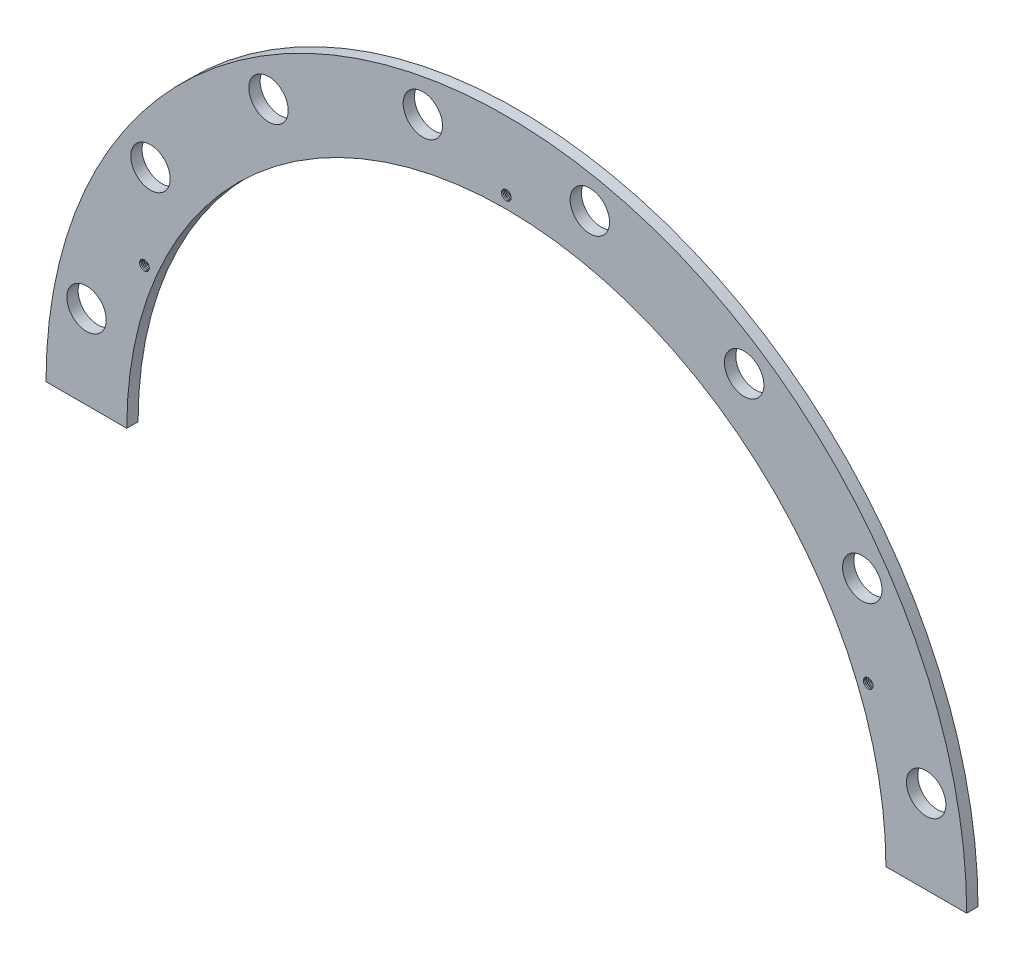
from build123d import *

# Parameters (mm, degrees)
ESTRUSIONE_ESTRUSIONE1_DEPTH = 7
SCHIZZO2_R                   = 12.2
TAGLIO_ESTRUSIONE1_DEPTH     = 404.111647066
RIPETIZIONECIRCOLARE1_COUNT  = 8
RIPETIZIONECIRCOLARE1_ANGLE  = 157.5
SCHIZZO3_R                   = 3
TAGLIO_ESTRUSIONE2_DEPTH     = 404.111647066
RIPETIZIONECIRCOLARE2_COUNT  = 3
RIPETIZIONECIRCOLARE2_ANGLE  = 135
FILETTATURA1_PITCH           = 1
FILETTATURA2_PITCH           = 1
FILETTATURA3_PITCH           = 1


with BuildPart() as part:
    # Schizzo1 → Estrusione-Estrusione1 (new body)
    with BuildSketch(Plane.XY):
        with BuildLine():
            Line((-285, 0), (-235, 0))
            ThreePointArc((-235, 0), (0, 235), (235, 0))
            Line((235, 0), (285, 0))
            ThreePointArc((285, 0), (0, 285), (-285, 0))
        make_face()
    extrude(amount=ESTRUSIONE_ESTRUSIONE1_DEPTH)

    # Schizzo2 → Taglio-Estrusione1 (cut, through all)
    with BuildSketch(Plane.XY.offset(7)):
        with Locations((-259.908099307, 51.698935334)):
            Circle(SCHIZZO2_R)
    taglio_estrusione1 = extrude(amount=-TAGLIO_ESTRUSIONE1_DEPTH, mode=Mode.SUBTRACT)

    # RipetizioneCircolare1: Taglio-Estrusione1 ×8 about axis
    ripetizionecircolare1_axis = Axis((0, 0, 0), (0, 0, -1))
    for i in range(1, RIPETIZIONECIRCOLARE1_COUNT):
        add(taglio_estrusione1.rotate(ripetizionecircolare1_axis, i * RIPETIZIONECIRCOLARE1_ANGLE / (RIPETIZIONECIRCOLARE1_COUNT - 1)), mode=Mode.SUBTRACT)

    # Schizzo3 → Taglio-Estrusione2 (cut, through all)
    with BuildSketch(Plane.XY.offset(7)):
        with Locations((-224.040786634, 92.800732349)):
            Circle(SCHIZZO3_R)
    taglio_estrusione2 = extrude(amount=-TAGLIO_ESTRUSIONE2_DEPTH, mode=Mode.SUBTRACT)

    # RipetizioneCircolare2: Taglio-Estrusione2 ×3 about axis
    ripetizionecircolare2_axis = Axis((0, 0, 0), (0, 0, -1))
    for i in range(1, RIPETIZIONECIRCOLARE2_COUNT):
        add(taglio_estrusione2.rotate(ripetizionecircolare2_axis, i * RIPETIZIONECIRCOLARE2_ANGLE / (RIPETIZIONECIRCOLARE2_COUNT - 1)), mode=Mode.SUBTRACT)

    # Filettatura1: arcs per turn and ends read off the stored shape
    # Filettatura1: the profile of Profilo filettatura1 profile screwed along a right-hand helix through 7 turns, 8 arcs to a turn; built about Z, then put on its axis
    filettatura1_z = Axis((0, 0, 0), (0, 0, 1))
    filettatura1_corners = [(2.9997, 0, -0.000173205), (3.541265875, 0, 0.312499999), (3.541265875, 0, 0.437499999), (2.9997, 0, 0.750173202)]
    with BuildLine(mode=Mode.PRIVATE) as filettatura1_profile:
        Line(filettatura1_corners[0], filettatura1_corners[1])
        Line(filettatura1_corners[1], filettatura1_corners[2])
        Line(filettatura1_corners[2], filettatura1_corners[3])
        Line(filettatura1_corners[3], filettatura1_corners[0])
    filettatura1_cap = Face(filettatura1_profile.wire())
    filettatura1_turn_angles = [0, 22.5, 45, 67.5, 90, 112.5, 135, 157.5, 180, 202.5, 225, 247.5, 270, 292.5, 315, 337.5, 360]
    filettatura1_turn_weights = [1, 0.9238795325112867, 1, 0.9238795325112867, 1, 0.9238795325112867, 1, 0.9238795325112867, 1, 0.9238795325112867, 1, 0.9238795325112867, 1, 0.9238795325112867, 1, 0.9238795325112867, 1]
    filettatura1_turn_rails = [Edge.make_bspline([Vector(p[0], p[1], 0).rotate(filettatura1_z, filettatura1_turn_angles[k]) / filettatura1_turn_weights[k] + Vector(0, 0, p[2] + FILETTATURA1_PITCH * filettatura1_turn_angles[k] / 360) for k in range(17)], [0, 0, 0, 1, 1, 2, 2, 3, 3, 4, 4, 5, 5, 6, 6, 7, 7, 8, 8, 8], 2, filettatura1_turn_weights) for p in filettatura1_corners]
    filettatura1_turn_sides = [Face.make_surface_from_curves(filettatura1_turn_rails[p[0]], filettatura1_turn_rails[p[1]]) for p in [(0, 1), (1, 2), (2, 3), (3, 0)]]
    filettatura1 = Plane(origin=(0, 242.5, 7), x_dir=(-1, 0, 0), z_dir=(0, 0, -1)) * Solid(Shell([*[p.moved(Location((0, 0, FILETTATURA1_PITCH * i))) for i in range(7) for p in filettatura1_turn_sides], filettatura1_cap, filettatura1_cap.rotate(filettatura1_z, 2520).moved(Location((0, 0, FILETTATURA1_PITCH * 2520 / 360)))]))
    add(filettatura1, mode=Mode.SUBTRACT)

    # Filettatura2: arcs per turn and ends read off the stored shape
    # Filettatura2: the profile of Profilo filettatura2 profile screwed along a right-hand helix through 7 turns, 8 arcs to a turn; built about Z, then put on its axis
    filettatura2_z = Axis((0, 0, 0), (0, 0, 1))
    filettatura2_corners = [(2.9997, 0, -0.000173205), (3.541265875, 0, 0.312499999), (3.541265875, 0, 0.437499999), (2.9997, 0, 0.750173202)]
    with BuildLine(mode=Mode.PRIVATE) as filettatura2_profile:
        Line(filettatura2_corners[0], filettatura2_corners[1])
        Line(filettatura2_corners[1], filettatura2_corners[2])
        Line(filettatura2_corners[2], filettatura2_corners[3])
        Line(filettatura2_corners[3], filettatura2_corners[0])
    filettatura2_cap = Face(filettatura2_profile.wire())
    filettatura2_turn_angles = [0, 22.5, 45, 67.5, 90, 112.5, 135, 157.5, 180, 202.5, 225, 247.5, 270, 292.5, 315, 337.5, 360]
    filettatura2_turn_weights = [1, 0.9238795325112867, 1, 0.9238795325112867, 1, 0.9238795325112867, 1, 0.9238795325112867, 1, 0.9238795325112867, 1, 0.9238795325112867, 1, 0.9238795325112867, 1, 0.9238795325112867, 1]
    filettatura2_turn_rails = [Edge.make_bspline([Vector(p[0], p[1], 0).rotate(filettatura2_z, filettatura2_turn_angles[k]) / filettatura2_turn_weights[k] + Vector(0, 0, p[2] + FILETTATURA2_PITCH * filettatura2_turn_angles[k] / 360) for k in range(17)], [0, 0, 0, 1, 1, 2, 2, 3, 3, 4, 4, 5, 5, 6, 6, 7, 7, 8, 8, 8], 2, filettatura2_turn_weights) for p in filettatura2_corners]
    filettatura2_turn_sides = [Face.make_surface_from_curves(filettatura2_turn_rails[p[0]], filettatura2_turn_rails[p[1]]) for p in [(0, 1), (1, 2), (2, 3), (3, 0)]]
    filettatura2 = Plane(origin=(-224.040786634, 92.800732349, 7), x_dir=(-1, 0, 0), z_dir=(0, 0, -1)) * Solid(Shell([*[p.moved(Location((0, 0, FILETTATURA2_PITCH * i))) for i in range(7) for p in filettatura2_turn_sides], filettatura2_cap, filettatura2_cap.rotate(filettatura2_z, 2520).moved(Location((0, 0, FILETTATURA2_PITCH * 2520 / 360)))]))
    add(filettatura2, mode=Mode.SUBTRACT)

    # Filettatura3: arcs per turn and ends read off the stored shape
    # Filettatura3: the profile of Profilo filettatura3 profile screwed along a right-hand helix through 7 turns, 8 arcs to a turn; built about Z, then put on its axis
    filettatura3_z = Axis((0, 0, 0), (0, 0, 1))
    filettatura3_corners = [(2.9997, 0, -0.000173205), (3.541265875, 0, 0.312499999), (3.541265875, 0, 0.437499999), (2.9997, 0, 0.750173202)]
    with BuildLine(mode=Mode.PRIVATE) as filettatura3_profile:
        Line(filettatura3_corners[0], filettatura3_corners[1])
        Line(filettatura3_corners[1], filettatura3_corners[2])
        Line(filettatura3_corners[2], filettatura3_corners[3])
        Line(filettatura3_corners[3], filettatura3_corners[0])
    filettatura3_cap = Face(filettatura3_profile.wire())
    filettatura3_turn_angles = [0, 22.5, 45, 67.5, 90, 112.5, 135, 157.5, 180, 202.5, 225, 247.5, 270, 292.5, 315, 337.5, 360]
    filettatura3_turn_weights = [1, 0.9238795325112867, 1, 0.9238795325112867, 1, 0.9238795325112867, 1, 0.9238795325112867, 1, 0.9238795325112867, 1, 0.9238795325112867, 1, 0.9238795325112867, 1, 0.9238795325112867, 1]
    filettatura3_turn_rails = [Edge.make_bspline([Vector(p[0], p[1], 0).rotate(filettatura3_z, filettatura3_turn_angles[k]) / filettatura3_turn_weights[k] + Vector(0, 0, p[2] + FILETTATURA3_PITCH * filettatura3_turn_angles[k] / 360) for k in range(17)], [0, 0, 0, 1, 1, 2, 2, 3, 3, 4, 4, 5, 5, 6, 6, 7, 7, 8, 8, 8], 2, filettatura3_turn_weights) for p in filettatura3_corners]
    filettatura3_turn_sides = [Face.make_surface_from_curves(filettatura3_turn_rails[p[0]], filettatura3_turn_rails[p[1]]) for p in [(0, 1), (1, 2), (2, 3), (3, 0)]]
    filettatura3 = Plane(origin=(224.040786634, 92.800732349, 7), x_dir=(-1, 0, 0), z_dir=(0, 0, -1)) * Solid(Shell([*[p.moved(Location((0, 0, FILETTATURA3_PITCH * i))) for i in range(7) for p in filettatura3_turn_sides], filettatura3_cap, filettatura3_cap.rotate(filettatura3_z, 2520).moved(Location((0, 0, FILETTATURA3_PITCH * 2520 / 360)))]))
    add(filettatura3, mode=Mode.SUBTRACT)


solid = part.part
